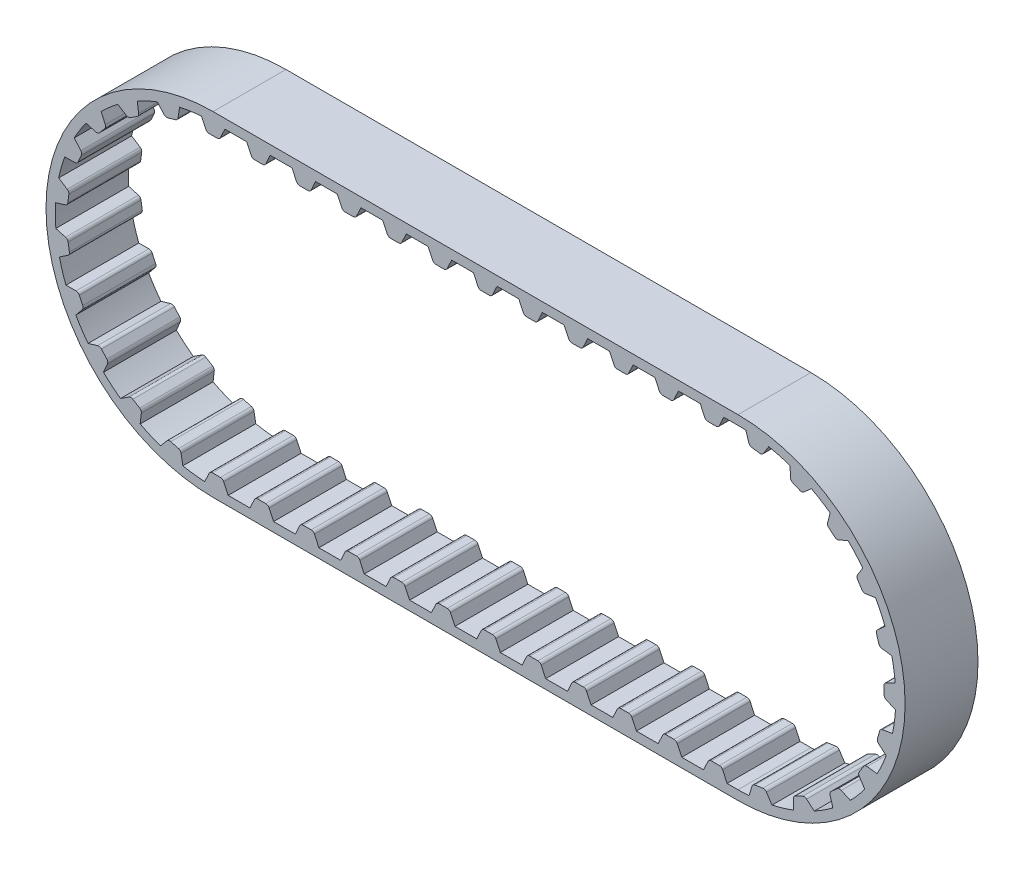
from build123d import *

# Parameters (mm, degrees)
BOSS_EXTRUDE1_DEPTH      = 3.96875
BOSS_EXTRUDE1_DEPTH_BACK = 3.96875
BOSS_EXTRUDE2_DEPTH      = 3.96875
FILLET1_R                = 0.396875
CRVPATTERN1_START        = -3.96875
CRVPATTERN1_DEPTH        = 7.9375


# Read off the part's stored shape, not the designer's step: CrvPattern1
with BuildPart() as part:
    # Sketch4 → Boss-Extrude1 (new, two sides: drawn at the far end of the back side and taken through both)
    with BuildSketch(Plane.XY.offset(-BOSS_EXTRUDE1_DEPTH_BACK)):
        with BuildLine():
            Line((-28.575, -18.191409995), (28.575, -18.191409995))
            ThreePointArc((28.575, -18.191409995), (46.766409995, 0), (28.575, 18.191409995))
            Line((28.575, 18.191409995), (-28.575, 18.191409995))
            ThreePointArc((-28.575, 18.191409995), (-46.766409995, 0), (-28.575, -18.191409995))
        make_face()
        with BuildLine():
            Line((-28.575, -17.175409995), (28.575, -17.175409995))
            ThreePointArc((28.575, -17.175409995), (45.750409995, 0), (28.575, 17.175409995))
            Line((28.575, 17.175409995), (-28.575, 17.175409995))
            ThreePointArc((-28.575, 17.175409995), (-45.750409995, 0), (-28.575, -17.175409995))
        make_face(mode=Mode.SUBTRACT)
    extrude(amount=BOSS_EXTRUDE1_DEPTH + BOSS_EXTRUDE1_DEPTH_BACK)

    # Sketch5 → Boss-Extrude2 (add, symmetric)
    with BuildSketch(Plane.XY):
        Polygon((-29.8577, 17.175409995), (-29.265489274, 15.905409995), (-27.884510726, 15.905409995), (-27.2923, 17.175409995), align=None)
    extrude(amount=BOSS_EXTRUDE2_DEPTH, both=True)

    # Fillet1
    fillet1_edges = [part.edges().sort_by_distance(p)[0] for p in [
        (-29.265489274, 15.905409995, 0),
        (-27.884510726, 15.905409995, 0),
    ]]
    fillet(fillet1_edges, radius=FILLET1_R)

    # CrvPattern1 outline → CrvPattern1 (add)
    with BuildSketch(Plane.XY.offset(CRVPATTERN1_START)):
        with BuildLine():
            Line((-22.839517444, 16.134558373), (-22.354160362, 17.175409995))
            Line((-22.354160362, 17.175409995), (-24.919560362, 17.175409995))
            Line((-24.919560362, 17.175409995), (-24.434203279, 16.134558373))
            ThreePointArc((-24.434203279, 16.134558373), (-24.287753158, 15.967564015), (-24.074512376, 15.905409995))
            Line((-24.074512376, 15.905409995), (-23.199208347, 15.905409995))
            ThreePointArc((-23.199208347, 15.905409995), (-22.985967565, 15.967564015), (-22.839517444, 16.134558373))
        make_face()
        with BuildLine():
            Line((-17.901377806, 16.134558373), (-17.416020723, 17.175409995))
            Line((-17.416020723, 17.175409995), (-19.981420723, 17.175409995))
            Line((-19.981420723, 17.175409995), (-19.496063641, 16.134558373))
            ThreePointArc((-19.496063641, 16.134558373), (-19.34961352, 15.967564015), (-19.136372738, 15.905409995))
            Line((-19.136372738, 15.905409995), (-18.261068709, 15.905409995))
            ThreePointArc((-18.261068709, 15.905409995), (-18.047827927, 15.967564015), (-17.901377806, 16.134558373))
        make_face()
        with BuildLine():
            Line((-12.963238167, 16.134558373), (-12.477881085, 17.175409995))
            Line((-12.477881085, 17.175409995), (-15.043281085, 17.175409995))
            Line((-15.043281085, 17.175409995), (-14.557924002, 16.134558373))
            ThreePointArc((-14.557924002, 16.134558373), (-14.411473881, 15.967564015), (-14.198233099, 15.905409995))
            Line((-14.198233099, 15.905409995), (-13.32292907, 15.905409995))
            ThreePointArc((-13.32292907, 15.905409995), (-13.109688288, 15.967564015), (-12.963238167, 16.134558373))
        make_face()
        with BuildLine():
            Line((-8.025098529, 16.134558373), (-7.539741446, 17.175409995))
            Line((-7.539741446, 17.175409995), (-10.105141446, 17.175409995))
            Line((-10.105141446, 17.175409995), (-9.619784364, 16.134558373))
            ThreePointArc((-9.619784364, 16.134558373), (-9.473334243, 15.967564015), (-9.260093461, 15.905409995))
            Line((-9.260093461, 15.905409995), (-8.384789432, 15.905409995))
            ThreePointArc((-8.384789432, 15.905409995), (-8.17154865, 15.967564015), (-8.025098529, 16.134558373))
        make_face()
        with BuildLine():
            Line((-3.086958891, 16.134558373), (-2.601601808, 17.175409995))
            Line((-2.601601808, 17.175409995), (-5.167001808, 17.175409995))
            Line((-5.167001808, 17.175409995), (-4.681644725, 16.134558373))
            ThreePointArc((-4.681644725, 16.134558373), (-4.535194604, 15.967564015), (-4.321953822, 15.905409995))
            Line((-4.321953822, 15.905409995), (-3.446649794, 15.905409995))
            ThreePointArc((-3.446649794, 15.905409995), (-3.233409012, 15.967564015), (-3.086958891, 16.134558373))
        make_face()
        with BuildLine():
            Line((1.851180748, 16.134558373), (2.33653783, 17.175409995))
            Line((2.33653783, 17.175409995), (-0.22886217, 17.175409995))
            Line((-0.22886217, 17.175409995), (0.256494913, 16.134558373))
            ThreePointArc((0.256494913, 16.134558373), (0.402945034, 15.967564015), (0.616185816, 15.905409995))
            Line((0.616185816, 15.905409995), (1.491489845, 15.905409995))
            ThreePointArc((1.491489845, 15.905409995), (1.704730627, 15.967564015), (1.851180748, 16.134558373))
        make_face()
        with BuildLine():
            Line((6.789320386, 16.134558373), (7.274677469, 17.175409995))
            Line((7.274677469, 17.175409995), (4.709277469, 17.175409995))
            Line((4.709277469, 17.175409995), (5.194634551, 16.134558373))
            ThreePointArc((5.194634551, 16.134558373), (5.341084672, 15.967564015), (5.554325454, 15.905409995))
            Line((5.554325454, 15.905409995), (6.429629483, 15.905409995))
            ThreePointArc((6.429629483, 15.905409995), (6.642870265, 15.967564015), (6.789320386, 16.134558373))
        make_face()
        with BuildLine():
            Line((11.727460025, 16.134558373), (12.212817107, 17.175409995))
            Line((12.212817107, 17.175409995), (9.647417107, 17.175409995))
            Line((9.647417107, 17.175409995), (10.13277419, 16.134558373))
            ThreePointArc((10.13277419, 16.134558373), (10.279224311, 15.967564015), (10.492465093, 15.905409995))
            Line((10.492465093, 15.905409995), (11.367769122, 15.905409995))
            ThreePointArc((11.367769122, 15.905409995), (11.581009904, 15.967564015), (11.727460025, 16.134558373))
        make_face()
        with BuildLine():
            Line((16.665599663, 16.134558373), (17.150956746, 17.175409995))
            Line((17.150956746, 17.175409995), (14.585556746, 17.175409995))
            Line((14.585556746, 17.175409995), (15.070913828, 16.134558373))
            ThreePointArc((15.070913828, 16.134558373), (15.217363949, 15.967564015), (15.430604731, 15.905409995))
            Line((15.430604731, 15.905409995), (16.30590876, 15.905409995))
            ThreePointArc((16.30590876, 15.905409995), (16.519149542, 15.967564015), (16.665599663, 16.134558373))
        make_face()
        with BuildLine():
            Line((21.603739301, 16.134558373), (22.089096384, 17.175409995))
            Line((22.089096384, 17.175409995), (19.523696384, 17.175409995))
            Line((19.523696384, 17.175409995), (20.009053467, 16.134558373))
            ThreePointArc((20.009053467, 16.134558373), (20.155503588, 15.967564015), (20.36874437, 15.905409995))
            Line((20.36874437, 15.905409995), (21.244048398, 15.905409995))
            ThreePointArc((21.244048398, 15.905409995), (21.45728918, 15.967564015), (21.603739301, 16.134558373))
        make_face()
        with BuildLine():
            ThreePointArc((-32.222922717, 16.783544571), (-33.445386497, 16.47039902), (-34.641558339, 16.068340874))
            Line((-34.641558339, 16.068340874), (-33.914848729, 15.246171492))
            ThreePointArc((-33.914848729, 15.246171492), (-33.727055891, 15.127560349), (-33.504943297, 15.128425744))
            Line((-33.504943297, 15.128425744), (-32.66556848, 15.376633439))
            ThreePointArc((-32.66556848, 15.376633439), (-32.478705595, 15.496704316), (-32.385621071, 15.698372421))
            Line((-32.385621071, 15.698372421), (-32.222922717, 16.783544571))
        make_face()
        with BuildLine():
            ThreePointArc((-36.832450136, 15.060186777), (-37.915936724, 14.413244244), (-38.948997883, 13.688494308))
            Line((-38.948997883, 13.688494308), (-38.018977587, 13.106144244))
            ThreePointArc((-38.018977587, 13.106144244), (-37.805258957, 13.045653744), (-37.592508971, 13.109467509))
            Line((-37.592508971, 13.109467509), (-36.857972167, 13.585506192))
            ThreePointArc((-36.857972167, 13.585506192), (-36.71282776, 13.75363666), (-36.680750643, 13.973422492))
            Line((-36.680750643, 13.973422492), (-36.832450136, 15.060186777))
        make_face()
        with BuildLine():
            ThreePointArc((-40.76407898, 12.100457105), (-41.619639124, 11.172828587), (-42.404780045, 10.184885489))
            Line((-42.404780045, 10.184885489), (-41.347799438, 9.890162998))
            ThreePointArc((-41.347799438, 9.890162998), (-41.125700331, 9.892759131), (-40.939778745, 10.01428245))
            Line((-40.939778745, 10.01428245), (-40.370382039, 10.67907154))
            ThreePointArc((-40.370382039, 10.67907154), (-40.278871796, 10.881458864), (-40.310435469, 11.101319019))
            Line((-40.310435469, 11.101319019), (-40.76407898, 12.100457105))
        make_face()
        with BuildLine():
            ThreePointArc((-43.695040653, 8.147335709), (-44.252436812, 7.01517523), (-44.725201045, 5.845144543))
            Line((-44.725201045, 5.845144543), (-43.628033362, 5.86224498))
            ThreePointArc((-43.628033362, 5.86224498), (-43.41578709, 5.927714616), (-43.271957209, 6.096970986))
            Line((-43.271957209, 6.096970986), (-42.914445444, 6.895934365))
            ThreePointArc((-42.914445444, 6.895934365), (-42.884081934, 7.115963478), (-42.976695166, 7.317848452))
            Line((-42.976695166, 7.317848452), (-43.695040653, 8.147335709))
        make_face()
        with BuildLine():
            ThreePointArc((-45.384716721, 3.525355625), (-45.59818924, 2.281608339), (-45.719765021, 1.025544186))
            Line((-45.719765021, 1.025544186), (-44.672482669, 1.353063686))
            ThreePointArc((-44.672482669, 1.353063686), (-44.487513672, 1.47603207), (-44.397583266, 1.679126322))
            Line((-44.397583266, 1.679126322), (-44.281306509, 2.546672781))
            ThreePointArc((-44.281306509, 2.546672781), (-44.314582436, 2.766280309), (-44.460642107, 2.933616276))
            Line((-44.460642107, 2.933616276), (-45.384716721, 3.525355625))
        make_face()
        with BuildLine():
            ThreePointArc((-45.694392568, -1.386039897), (-45.546416339, -2.639268074), (-45.306822858, -3.878248619))
            Line((-45.306822858, -3.878248619), (-44.395402887, -3.267197897))
            ThreePointArc((-44.395402887, -3.267197897), (-44.252896267, -3.096825903), (-44.224248207, -2.876566869))
            Line((-44.224248207, -2.876566869), (-44.358752244, -2.011658893))
            ThreePointArc((-44.358752244, -2.011658893), (-44.452935809, -1.810501717), (-44.640451094, -1.691452268))
            Line((-44.640451094, -1.691452268), (-45.694392568, -1.386039897))
        make_face()
        with BuildLine():
            ThreePointArc((-44.598645238, -6.183647935), (-44.101368426, -7.343472749), (-43.520275203, -8.463655098))
            Line((-43.520275203, -8.463655098), (-42.81954099, -7.6192376))
            ThreePointArc((-42.81954099, -7.6192376), (-42.731195882, -7.41544875), (-42.766182043, -7.196107186))
            Line((-42.766182043, -7.196107186), (-43.140424712, -6.404842649))
            ThreePointArc((-43.140424712, -6.404842649), (-43.287783878, -6.238649901), (-43.501360636, -6.17766038))
            Line((-43.501360636, -6.17766038), (-44.598645238, -6.183647935))
        make_face()
        with BuildLine():
            ThreePointArc((-42.187430532, -10.473606996), (-41.381677269, -11.444812179), (-40.506789378, -12.354234527))
            Line((-40.506789378, -12.354234527), (-40.07426797, -11.345773035))
            ThreePointArc((-40.07426797, -11.345773035), (-40.047337101, -11.125297455), (-40.14308528, -10.924880291))
            Line((-40.14308528, -10.924880291), (-40.726342985, -10.272218362))
            ThreePointArc((-40.726342985, -10.272218362), (-40.914780243, -10.154633699), (-41.136884808, -10.156711066))
            Line((-41.136884808, -10.156711066), (-42.187430532, -10.473606996))
        make_face()
        with BuildLine():
            ThreePointArc((-38.658698058, -13.903731225), (-37.610616972, -14.606585311), (-36.513758673, -15.230588276))
            Line((-36.513758673, -15.230588276), (-36.384958083, -14.140872829))
            ThreePointArc((-36.384958083, -14.140872829), (-36.421652353, -13.921810546), (-36.570302066, -13.756771107))
            Line((-36.570302066, -13.756771107), (-37.314692038, -13.296292321))
            ThreePointArc((-37.314692038, -13.296292321), (-37.52873756, -13.236968903), (-37.741136171, -13.301942614))
            Line((-37.741136171, -13.301942614), (-38.658698058, -13.903731225))
        make_face()
        with BuildLine():
            ThreePointArc((-34.302140477, -16.192423242), (-33.097774191, -16.569225151), (-31.868992493, -16.856580969))
            Line((-31.868992493, -16.856580969), (-32.054486655, -15.775072178))
            ThreePointArc((-32.054486655, -15.775072178), (-32.151793634, -15.575407196), (-32.341141425, -15.459294459))
            Line((-32.341141425, -15.459294459), (-33.185552681, -15.228802001))
            ThreePointArc((-33.185552681, -15.228802001), (-33.407634316, -15.232610006), (-33.592890027, -15.35514602))
            Line((-33.592890027, -15.35514602), (-34.302140477, -16.192423242))
        make_face()
        with BuildLine():
            Line((-28.575, -17.175409995), (-26.930905842, -17.175409995))
            Line((-26.930905842, -17.175409995), (-27.416262924, -16.134558373))
            ThreePointArc((-27.416262924, -16.134558373), (-27.562713045, -15.967564015), (-27.775953827, -15.905409995))
            Line((-27.775953827, -15.905409995), (-28.651257856, -15.905409995))
            ThreePointArc((-28.651257856, -15.905409995), (-28.864498638, -15.967564015), (-29.010948759, -16.134558373))
            Line((-29.010948759, -16.134558373), (-29.485055231, -17.151282983))
            ThreePointArc((-29.485055231, -17.151282983), (-29.030187499, -17.169377183), (-28.575, -17.175409995))
        make_face()
        with BuildLine():
            Line((-24.558166203, -17.175409995), (-21.992766203, -17.175409995))
            Line((-21.992766203, -17.175409995), (-22.478123286, -16.134558373))
            ThreePointArc((-22.478123286, -16.134558373), (-22.624573407, -15.967564015), (-22.837814189, -15.905409995))
            Line((-22.837814189, -15.905409995), (-23.713118218, -15.905409995))
            ThreePointArc((-23.713118218, -15.905409995), (-23.926359, -15.967564015), (-24.072809121, -16.134558373))
            Line((-24.072809121, -16.134558373), (-24.558166203, -17.175409995))
        make_face()
        with BuildLine():
            Line((-19.620026565, -17.175409995), (-17.054626565, -17.175409995))
            Line((-17.054626565, -17.175409995), (-17.539983647, -16.134558373))
            ThreePointArc((-17.539983647, -16.134558373), (-17.686433768, -15.967564015), (-17.89967455, -15.905409995))
            Line((-17.89967455, -15.905409995), (-18.774978579, -15.905409995))
            ThreePointArc((-18.774978579, -15.905409995), (-18.988219361, -15.967564015), (-19.134669482, -16.134558373))
            Line((-19.134669482, -16.134558373), (-19.620026565, -17.175409995))
        make_face()
        with BuildLine():
            Line((-14.681886926, -17.175409995), (-12.116486926, -17.175409995))
            Line((-12.116486926, -17.175409995), (-12.601844009, -16.134558373))
            ThreePointArc((-12.601844009, -16.134558373), (-12.74829413, -15.967564015), (-12.961534912, -15.905409995))
            Line((-12.961534912, -15.905409995), (-13.836838941, -15.905409995))
            ThreePointArc((-13.836838941, -15.905409995), (-14.050079723, -15.967564015), (-14.196529844, -16.134558373))
            Line((-14.196529844, -16.134558373), (-14.681886926, -17.175409995))
        make_face()
        with BuildLine():
            Line((-9.743747288, -17.175409995), (-7.178347288, -17.175409995))
            Line((-7.178347288, -17.175409995), (-7.663704371, -16.134558373))
            ThreePointArc((-7.663704371, -16.134558373), (-7.810154492, -15.967564015), (-8.023395274, -15.905409995))
            Line((-8.023395274, -15.905409995), (-8.898699302, -15.905409995))
            ThreePointArc((-8.898699302, -15.905409995), (-9.111940084, -15.967564015), (-9.258390205, -16.134558373))
            Line((-9.258390205, -16.134558373), (-9.743747288, -17.175409995))
        make_face()
        with BuildLine():
            Line((-4.80560765, -17.175409995), (-2.24020765, -17.175409995))
            Line((-2.24020765, -17.175409995), (-2.725564732, -16.134558373))
            ThreePointArc((-2.725564732, -16.134558373), (-2.872014853, -15.967564015), (-3.085255635, -15.905409995))
            Line((-3.085255635, -15.905409995), (-3.960559664, -15.905409995))
            ThreePointArc((-3.960559664, -15.905409995), (-4.173800446, -15.967564015), (-4.320250567, -16.134558373))
            Line((-4.320250567, -16.134558373), (-4.80560765, -17.175409995))
        make_face()
        with BuildLine():
            Line((0.132531989, -17.175409995), (2.697931989, -17.175409995))
            Line((2.697931989, -17.175409995), (2.212574906, -16.134558373))
            ThreePointArc((2.212574906, -16.134558373), (2.066124785, -15.967564015), (1.852884003, -15.905409995))
            Line((1.852884003, -15.905409995), (0.977579974, -15.905409995))
            ThreePointArc((0.977579974, -15.905409995), (0.764339192, -15.967564015), (0.617889071, -16.134558373))
            Line((0.617889071, -16.134558373), (0.132531989, -17.175409995))
        make_face()
        with BuildLine():
            Line((5.070671627, -17.175409995), (7.636071627, -17.175409995))
            Line((7.636071627, -17.175409995), (7.150714545, -16.134558373))
            ThreePointArc((7.150714545, -16.134558373), (7.004264424, -15.967564015), (6.791023642, -15.905409995))
            Line((6.791023642, -15.905409995), (5.915719613, -15.905409995))
            ThreePointArc((5.915719613, -15.905409995), (5.702478831, -15.967564015), (5.55602871, -16.134558373))
            Line((5.55602871, -16.134558373), (5.070671627, -17.175409995))
        make_face()
        with BuildLine():
            Line((10.008811266, -17.175409995), (12.574211266, -17.175409995))
            Line((12.574211266, -17.175409995), (12.088854183, -16.134558373))
            ThreePointArc((12.088854183, -16.134558373), (11.942404062, -15.967564015), (11.72916328, -15.905409995))
            Line((11.72916328, -15.905409995), (10.853859251, -15.905409995))
            ThreePointArc((10.853859251, -15.905409995), (10.640618469, -15.967564015), (10.494168348, -16.134558373))
            Line((10.494168348, -16.134558373), (10.008811266, -17.175409995))
        make_face()
        with BuildLine():
            Line((14.946950904, -17.175409995), (17.512350904, -17.175409995))
            Line((17.512350904, -17.175409995), (17.026993821, -16.134558373))
            ThreePointArc((17.026993821, -16.134558373), (16.8805437, -15.967564015), (16.667302918, -15.905409995))
            Line((16.667302918, -15.905409995), (15.79199889, -15.905409995))
            ThreePointArc((15.79199889, -15.905409995), (15.578758108, -15.967564015), (15.432307987, -16.134558373))
            Line((15.432307987, -16.134558373), (14.946950904, -17.175409995))
        make_face()
        with BuildLine():
            Line((19.885090542, -17.175409995), (22.450490542, -17.175409995))
            Line((22.450490542, -17.175409995), (21.96513346, -16.134558373))
            ThreePointArc((21.96513346, -16.134558373), (21.818683339, -15.967564015), (21.605442557, -15.905409995))
            Line((21.605442557, -15.905409995), (20.730138528, -15.905409995))
            ThreePointArc((20.730138528, -15.905409995), (20.516897746, -15.967564015), (20.370447625, -16.134558373))
            Line((20.370447625, -16.134558373), (19.885090542, -17.175409995))
        make_face()
        with BuildLine():
            Line((24.823230181, -17.175409995), (27.388630181, -17.175409995))
            Line((27.388630181, -17.175409995), (26.903273098, -16.134558373))
            ThreePointArc((26.903273098, -16.134558373), (26.756822977, -15.967564015), (26.543582195, -15.905409995))
            Line((26.543582195, -15.905409995), (25.668278166, -15.905409995))
            ThreePointArc((25.668278166, -15.905409995), (25.455037384, -15.967564015), (25.308587263, -16.134558373))
            Line((25.308587263, -16.134558373), (24.823230181, -17.175409995))
        make_face()
        with BuildLine():
            ThreePointArc((29.780858776, -17.133026969), (31.035574379, -16.998243504), (32.277006998, -16.771697967))
            Line((32.277006998, -16.771697967), (31.675578678, -15.853899882))
            ThreePointArc((31.675578678, -15.853899882), (31.506715352, -15.709608751), (31.2867699, -15.678645044))
            Line((31.2867699, -15.678645044), (30.420494741, -15.804042381))
            ThreePointArc((30.420494741, -15.804042381), (30.21835784, -15.896104461), (30.097342226, -16.082356909))
            Line((30.097342226, -16.082356909), (29.780858776, -17.133026969))
        make_face()
        with BuildLine():
            ThreePointArc((34.589729106, -16.087813471), (35.754721329, -15.602766105), (36.880955071, -15.03348991))
            Line((36.880955071, -15.03348991), (36.043956372, -14.32391079))
            ThreePointArc((36.043956372, -14.32391079), (35.841108234, -14.233426613), (35.621410737, -14.266103257))
            Line((35.621410737, -14.266103257), (34.826252774, -14.632000723))
            ThreePointArc((34.826252774, -14.632000723), (34.658518932, -14.777603304), (34.595285854, -14.990526603))
            Line((34.595285854, -14.990526603), (34.589729106, -16.087813471))
        make_face()
        with BuildLine():
            ThreePointArc((38.904817915, -13.721864682), (39.884446269, -12.926373566), (40.803022538, -12.061101663))
            Line((40.803022538, -12.061101663), (39.799167194, -11.617994682))
            ThreePointArc((39.799167194, -11.617994682), (39.578987141, -11.588745792), (39.37757375, -11.682380185))
            Line((39.37757375, -11.682380185), (38.718811784, -12.258739287))
            ThreePointArc((38.718811784, -12.258739287), (38.599251176, -12.445929069), (38.598991778, -12.668043197))
            Line((38.598991778, -12.668043197), (38.904817915, -13.721864682))
        make_face()
        with BuildLine():
            ThreePointArc((42.371876312, -10.229414086), (43.085717828, -9.188785373), (43.721225747, -8.098552594))
            Line((43.721225747, -8.098552594), (42.632925652, -7.95829479))
            ThreePointArc((42.632925652, -7.95829479), (42.413489451, -7.992682387), (42.246895278, -8.139587577))
            Line((42.246895278, -8.139587577), (41.778610628, -8.87909189))
            ThreePointArc((41.778610628, -8.87909189), (41.717038629, -9.092501455), (41.779774206, -9.305571867))
            Line((41.779774206, -9.305571867), (42.371876312, -10.229414086))
        make_face()
        with BuildLine():
            ThreePointArc((44.706274793, -5.897175769), (45.095726374, -4.696840276), (45.395993675, -3.471149705))
            Line((45.395993675, -3.471149705), (44.312593248, -3.645255598))
            ThreePointArc((44.312593248, -3.645255598), (44.111915598, -3.740456618), (43.993817256, -3.928572367))
            Line((43.993817256, -3.928572367), (43.754453932, -4.770511998))
            ThreePointArc((43.754453932, -4.770511998), (43.755925319, -4.992621404), (43.87650557, -5.179156002))
            Line((43.87650557, -5.179156002), (44.706274793, -5.897175769))
        make_face()
        with BuildLine():
            ThreePointArc((45.716370008, -1.080806518), (45.749459475, 0.180693746), (45.689835598, 1.441218566))
            Line((45.689835598, 1.441218566), (44.700277017, 0.967042267))
            ThreePointArc((44.700277017, 0.967042267), (44.534832628, 0.818843388), (44.474925446, 0.604960516))
            Line((44.474925446, 0.604960516), (44.484134074, -0.270295072))
            ThreePointArc((44.484134074, -0.270295072), (44.548528052, -0.482870162), (44.717053895, -0.627555315))
            Line((44.717053895, -0.627555315), (45.716370008, -1.080806518))
        make_face()
        with BuildLine():
            ThreePointArc((45.319237799, 3.824291964), (44.993248659, 5.043393645), (44.578628449, 6.235269439))
            Line((44.578628449, 6.235269439), (43.76414991, 5.499950421))
            ThreePointArc((43.76414991, 5.499950421), (43.647521004, 5.310920128), (43.650723084, 5.088828931))
            Line((43.650723084, 5.088828931), (43.907747678, 4.252111834))
            ThreePointArc((43.907747678, 4.252111834), (44.029777799, 4.066522494), (44.232414039, 3.975564769))
            Line((44.232414039, 3.975564769), (45.319237799, 3.824291964))
        make_face()
        with BuildLine():
            ThreePointArc((43.547480888, 8.415433712), (42.889175347, 9.492054184), (42.15359721, 10.517433447))
            Line((42.15359721, 10.517433447), (41.581063645, 9.581338011))
            ThreePointArc((41.581063645, 9.581338011), (41.522824917, 9.366994819), (41.588873385, 9.154927959))
            Line((41.588873385, 9.154927959), (42.07261341, 8.425439967))
            ThreePointArc((42.07261341, 8.425439967), (42.242261564, 8.282072407), (42.462372699, 8.25230932))
            Line((42.462372699, 8.25230932), (43.547480888, 8.415433712))
        make_face()
        with BuildLine():
            ThreePointArc((40.546552346, 12.315707162), (39.609974253, 13.161460851), (38.613825762, 13.936164674))
            Line((38.613825762, 13.936164674), (38.330239536, 12.876141938))
            ThreePointArc((38.330239536, 12.876141938), (38.335172117, 12.654082435), (38.458644698, 12.469449623))
            Line((38.458644698, 12.469449623), (39.12938733, 11.907078336))
            ThreePointArc((39.12938733, 11.907078336), (39.332726186, 11.817702371), (39.552242108, 11.851577335))
            Line((39.552242108, 11.851577335), (40.546552346, 12.315707162))
        make_face()
        with BuildLine():
            ThreePointArc((36.562814568, 15.204917853), (35.424852664, 15.750372281), (34.249913017, 16.210801052))
            Line((34.249913017, 16.210801052), (34.278555251, 15.113873994))
            ThreePointArc((34.278555251, 15.113873994), (34.346254199, 14.902328241), (34.517014362, 14.76028698))
            Line((34.517014362, 14.76028698), (35.319694724, 14.411200487))
            ThreePointArc((35.319694724, 14.411200487), (35.540031099, 14.383153472), (35.740930564, 14.477885507))
            Line((35.740930564, 14.477885507), (36.562814568, 15.204917853))
        make_face()
        with BuildLine():
            ThreePointArc((31.923314052, 16.845874911), (30.677389761, 17.046250784), (29.420116084, 17.154605425))
            Line((29.420116084, 17.154605425), (29.758635384, 16.110826698))
            ThreePointArc((29.758635384, 16.110826698), (29.883542927, 15.927161625), (30.087572052, 15.839372847))
            Line((30.087572052, 15.839372847), (30.956293788, 15.73222954))
            ThreePointArc((30.956293788, 15.73222954), (31.175539082, 15.767814005), (31.341329169, 15.915626049))
            Line((31.341329169, 15.915626049), (31.923314052, 16.845874911))
        make_face()
        with BuildLine():
            Line((25.306884008, 15.905409995), (26.182188037, 15.905409995))
            ThreePointArc((26.182188037, 15.905409995), (26.395428819, 15.967564015), (26.54187894, 16.134558373))
            Line((26.54187894, 16.134558373), (27.027236022, 17.175409995))
            Line((27.027236022, 17.175409995), (24.461836022, 17.175409995))
            Line((24.461836022, 17.175409995), (24.947193105, 16.134558373))
            ThreePointArc((24.947193105, 16.134558373), (25.093643226, 15.967564015), (25.306884008, 15.905409995))
        make_face()
    extrude(amount=CRVPATTERN1_DEPTH)


solid = part.part
